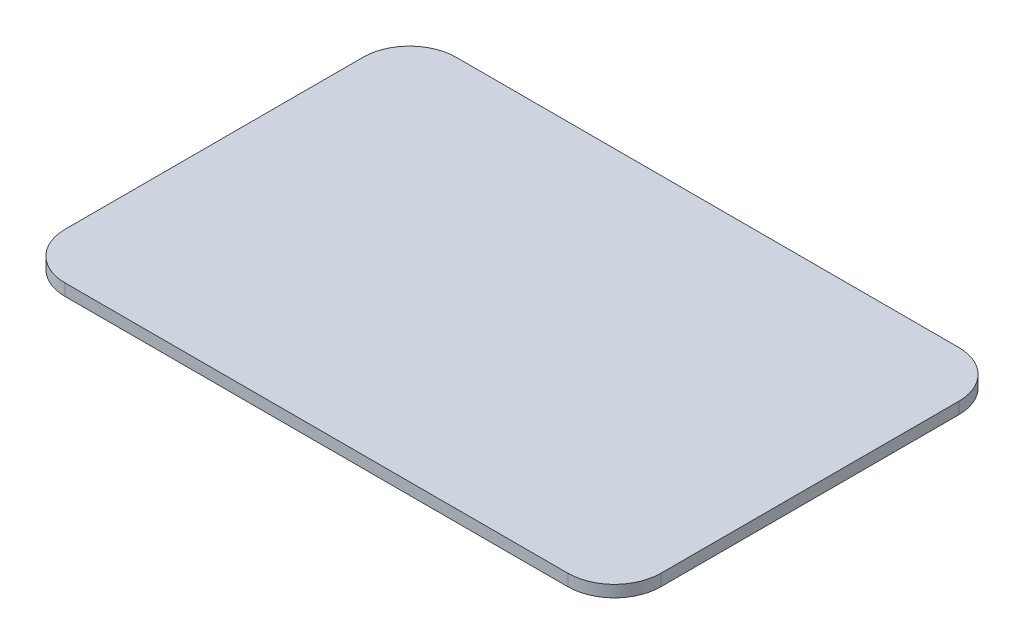
from build123d import *

# Parameters (mm, degrees)
SKETCH1_W           = 81.28
SKETCH1_H           = 53.34
BOSS_EXTRUDE1_DEPTH = 1.6
FILLET1_R           = 6.35


with BuildPart() as part:
    # Sketch1 → Boss-Extrude1 (new body)
    with BuildSketch(Plane(origin=(0, 0, 0), x_dir=(1, 0, 0), z_dir=(0, 1, 0))):
        with Locations((40.64, 26.67)):
            Rectangle(SKETCH1_W, SKETCH1_H)
    extrude(amount=BOSS_EXTRUDE1_DEPTH)

    # Fillet1
    fillet1_edges = [part.edges().sort_by_distance(p)[0] for p in [
        (0, 0.8, -53.34),
        (81.28, 0.8, -53.34),
        (81.28, 0.8, 0),
        (0, 0.8, 0),
    ]]
    fillet(fillet1_edges, radius=FILLET1_R)


solid = part.part
